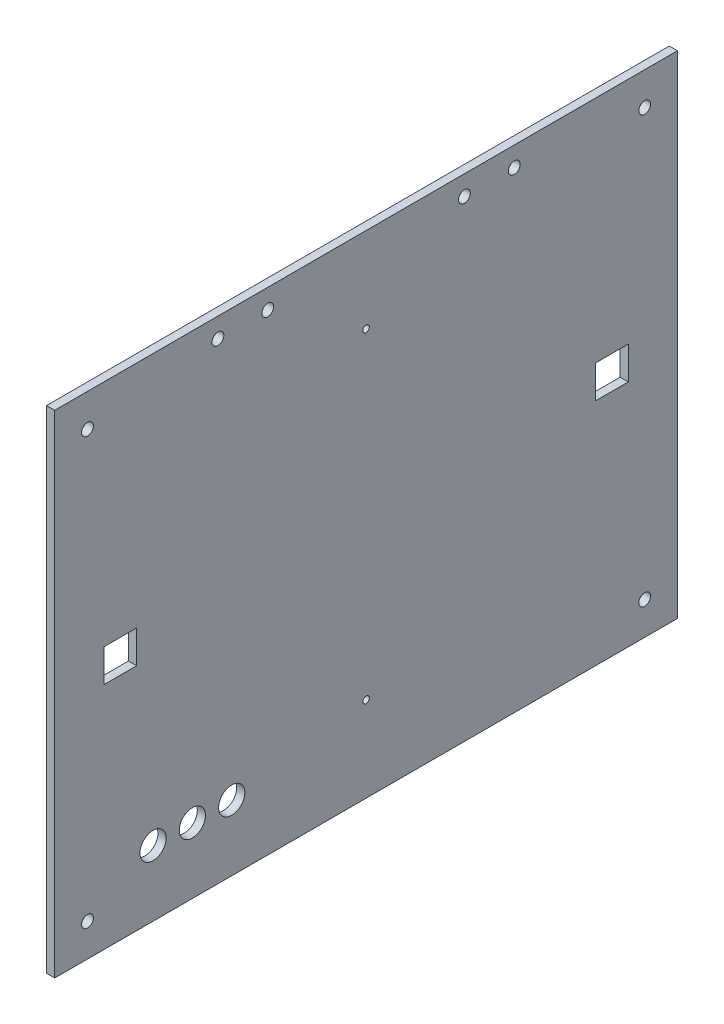
from build123d import *

# Parameters (mm, degrees)
SKETCH1_W                     = 241.3
SKETCH1_H                     = 190.5
MAIN_BODY_DEPTH               = 3.175
SKETCH2_R                     = 2.286
BOLT_HOLES_DEPTH              = 308.450842616
SKETCH3_R                     = 2.286
LOCKING_MECHANISM_HOLES_DEPTH = 308.450842616
SKETCH4_W                     = 12.7
SKETCH4_H                     = 12.7
LED_HOLES_DEPTH               = 308.450842616
SKETCH5_R                     = 1.27
LOGO_MOUNT_HOLES_DEPTH        = 308.450842616
SKETCH6_R                     = 5.08
PANEL_MOUNT_LED_HOLE_DEPTH    = 308.450842616


with BuildPart() as part:
    # Sketch1 → Main Body (new body)
    with BuildSketch(Plane(origin=(0, 0, 0), x_dir=(0, 0, -1), z_dir=(1, 0, 0))):
        with Locations((120.65, 95.25)):
            Rectangle(SKETCH1_W, SKETCH1_H)
    extrude(amount=MAIN_BODY_DEPTH)

    # Sketch2 → Bolt Holes (cut, through all)
    with BuildSketch(Plane(origin=(3.175, 0, 0), x_dir=(0, 0, -1), z_dir=(1, 0, 0))):
        with Locations((228.6, 12.7)):
            Circle(SKETCH2_R)
        with Locations((228.6, 177.8)):
            Circle(SKETCH2_R)
        with Locations((12.7, 12.7)):
            Circle(SKETCH2_R)
        with Locations((12.7, 177.8)):
            Circle(SKETCH2_R)
    extrude(amount=-BOLT_HOLES_DEPTH, mode=Mode.SUBTRACT)

    # Sketch3 → Locking Mechanism Holes (cut, through all)
    with BuildSketch(Plane(origin=(3.175, 0, 0), x_dir=(0, 0, -1), z_dir=(1, 0, 0))):
        with Locations((63.246, 182.88)):
            Circle(SKETCH3_R)
        with Locations((82.55, 182.88)):
            Circle(SKETCH3_R)
        with Locations((158.75, 182.88)):
            Circle(SKETCH3_R)
        with Locations((178.054, 182.88)):
            Circle(SKETCH3_R)
    extrude(amount=-LOCKING_MECHANISM_HOLES_DEPTH, mode=Mode.SUBTRACT)

    # Sketch4 → LED Holes (cut, through all)
    with BuildSketch(Plane(origin=(3.175, 0, 0), x_dir=(0, 0, -1), z_dir=(1, 0, 0))):
        with Locations((25.4, 95.25)):
            Rectangle(SKETCH4_W, SKETCH4_H)
        with Locations((215.9, 95.25)):
            Rectangle(SKETCH4_W, SKETCH4_H)
    extrude(amount=-LED_HOLES_DEPTH, mode=Mode.SUBTRACT)

    # Sketch5 → Logo Mount Holes (cut, through all)
    with BuildSketch(Plane(origin=(3.175, 0, 0), x_dir=(0, 0, -1), z_dir=(1, 0, 0))):
        with Locations((120.65, 157.48)):
            Circle(SKETCH5_R)
        with Locations((120.65, 33.02)):
            Circle(SKETCH5_R)
    extrude(amount=-LOGO_MOUNT_HOLES_DEPTH, mode=Mode.SUBTRACT)

    # Sketch6 → Panel Mount LED Hole (cut, through all)
    with BuildSketch(Plane(origin=(3.175, 0, 0), x_dir=(0, 0, -1), z_dir=(1, 0, 0))):
        with Locations((38.1, 25.4)):
            Circle(SKETCH6_R)
        with Locations((53.34, 25.4)):
            Circle(SKETCH6_R)
        with Locations((68.58, 25.4)):
            Circle(SKETCH6_R)
    extrude(amount=-PANEL_MOUNT_LED_HOLE_DEPTH, mode=Mode.SUBTRACT)


solid = part.part
